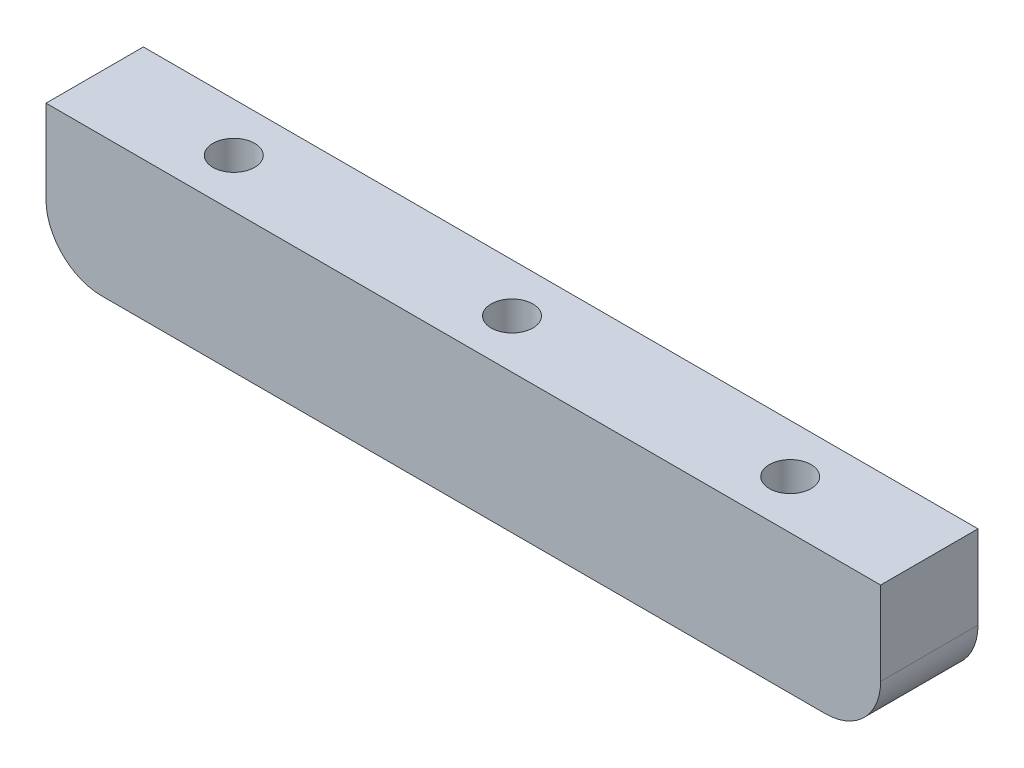
from build123d import *

# Parameters (mm, degrees)
SKETCH1_W           = 60
SKETCH1_H           = 7
BOSS_EXTRUDE1_DEPTH = 10
SKETCH2_R           = 1.5
CUT_EXTRUDE1_DEPTH  = 5
FILLET1_R           = 4


with BuildPart() as part:
    # Sketch1 → Boss-Extrude1 (new body)
    with BuildSketch(Plane(origin=(0, 0, 0), x_dir=(1, 0, 0), z_dir=(0, 1, 0))):
        Rectangle(SKETCH1_W, SKETCH1_H)
    extrude(amount=BOSS_EXTRUDE1_DEPTH)

    # Sketch2 → Cut-Extrude1 (cut)
    with BuildSketch(Plane(origin=(0, 10, 0), x_dir=(1, 0, 0), z_dir=(0, 1, 0))):
        Circle(SKETCH2_R)
        with Locations((20, 0)):
            Circle(SKETCH2_R)
        with Locations((-20, 0)):
            Circle(SKETCH2_R)
    extrude(amount=-CUT_EXTRUDE1_DEPTH, mode=Mode.SUBTRACT)

    # Fillet1
    fillet1_edges = [part.edges().sort_by_distance(p)[0] for p in [
        (-30, 0, 0),
        (30, 0, 0),
    ]]
    fillet(fillet1_edges, radius=FILLET1_R)


solid = part.part
